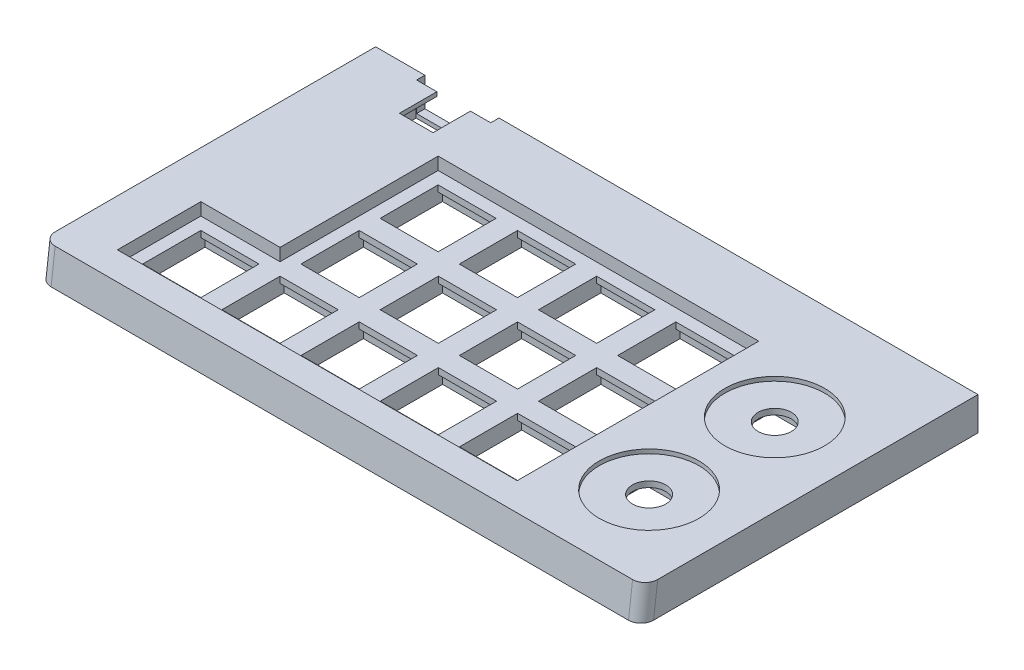
from build123d import *

# Parameters (mm, degrees)
SKETCH1_W           = 14
SKETCH1_H           = 14
SKETCH1_W_2         = 13.96
SKETCH1_H_2         = 13.96
SKETCH1_W_3         = 17.83
SKETCH1_H_3         = 34.365
SKETCH1_W_4         = 16.8
SKETCH1_H_4         = 14.955
BOSS_EXTRUDE2_DEPTH = 4
SKETCH3_W           = 14
SKETCH3_H           = 16
CUT_EXTRUDE1_DEPTH  = 2.5
SKETCH6_W           = 145
SKETCH6_H           = 81.124541
BOSS_EXTRUDE3_DEPTH = 7
SKETCH12_R          = 0.8
CUT_EXTRUDE5_DEPTH  = 6
SKETCH13_W          = 17.97
SKETCH13_H          = 46.826347
CUT_EXTRUDE6_DEPTH  = 6
SKETCH14_W          = 16.8
SKETCH14_H          = 14.955
CUT_EXTRUDE8_DEPTH  = 4.6
SKETCH15_R          = 4
CUT_EXTRUDE9_DEPTH  = 10
SKETCH16_R          = 12
CUT_EXTRUDE10_DEPTH = 1
SKETCH20_W          = 145
SKETCH20_H          = 81.124541
SKETCH20_W_2        = 130
SKETCH20_H_2        = 66.1
BOSS_EXTRUDE5_DEPTH = 1
SKETCH21_W          = 145
SKETCH21_H          = 34.866824831
CUT_EXTRUDE11_DEPTH = 18
FILLET1_R           = 3
SKETCH27_W          = 17.97
SKETCH27_H          = 5.776347
CUT_EXTRUDE13_DEPTH = 2
CUT_EXTRUDE14_START = -2
CUT_EXTRUDE14_DEPTH = 2
SKETCH28_W          = 17.854591413
SKETCH28_H          = 5
CUT_EXTRUDE15_DEPTH = 2


# Read off the part's stored shape, not the designer's step: Cut-Extrude14
with BuildPart() as part:
    # Sketch1 → Boss-Extrude2 (new body)
    with BuildSketch(Plane(origin=(0, 0, 0), x_dir=(1, 0, 0), z_dir=(0, 1, 0))):
        Polygon((0, 0), (109.34, 0), (130, 0), (130, 66.1), (0, 66.1), align=None)
        with Locations((51.87, 10.55)):
            Rectangle(SKETCH1_W, SKETCH1_H, mode=Mode.SUBTRACT)
        with Locations((32.81, 10.55)):
            Rectangle(SKETCH1_W, SKETCH1_H, mode=Mode.SUBTRACT)
        with Locations((32.81, 29.6)):
            Rectangle(SKETCH1_W, SKETCH1_H, mode=Mode.SUBTRACT)
        with Locations((32.79, 48.63)):
            Rectangle(SKETCH1_W_2, SKETCH1_H_2, mode=Mode.SUBTRACT)
        with Locations((13.145, 42.2325)):
            Rectangle(SKETCH1_W_3, SKETCH1_H_3, mode=Mode.SUBTRACT)
        with Locations((13.75, 10.55)):
            Rectangle(SKETCH1_W, SKETCH1_H, mode=Mode.SUBTRACT)
        with Locations((51.87, 29.6)):
            Rectangle(SKETCH1_W, SKETCH1_H, mode=Mode.SUBTRACT)
        with Locations((70.93, 10.55)):
            Rectangle(SKETCH1_W, SKETCH1_H, mode=Mode.SUBTRACT)
        with Locations((89.99, 10.55)):
            Rectangle(SKETCH1_W, SKETCH1_H, mode=Mode.SUBTRACT)
        with Locations((117.74, 14.4625)):
            Rectangle(SKETCH1_W_4, SKETCH1_H_4, mode=Mode.SUBTRACT)
        with Locations((70.93, 29.6)):
            Rectangle(SKETCH1_W, SKETCH1_H, mode=Mode.SUBTRACT)
        with Locations((89.99, 29.6)):
            Rectangle(SKETCH1_W, SKETCH1_H, mode=Mode.SUBTRACT)
        with Locations((51.87, 48.65)):
            Rectangle(SKETCH1_W, SKETCH1_H, mode=Mode.SUBTRACT)
        with Locations((70.93, 48.65)):
            Rectangle(SKETCH1_W, SKETCH1_H, mode=Mode.SUBTRACT)
        with Locations((89.99, 48.65)):
            Rectangle(SKETCH1_W, SKETCH1_H, mode=Mode.SUBTRACT)
        with Locations((117.74, 44.7175)):
            Rectangle(SKETCH1_W_4, SKETCH1_H_4, mode=Mode.SUBTRACT)
    extrude(amount=BOSS_EXTRUDE2_DEPTH)

    # Sketch3 → Cut-Extrude1 (cut)
    with BuildSketch(Plane(origin=(0, 0, 0), x_dir=(1, 0, 0), z_dir=(0, 1, 0))):
        with Locations((89.99, 29.6)):
            Rectangle(SKETCH3_W, SKETCH3_H)
        with Locations((70.93, 29.6)):
            Rectangle(SKETCH3_W, SKETCH3_H)
        with Locations((89.99, 48.65)):
            Rectangle(SKETCH3_W, SKETCH3_H)
        with Locations((70.93, 48.65)):
            Rectangle(SKETCH3_W, SKETCH3_H)
        with Locations((51.87, 48.65)):
            Rectangle(SKETCH3_W, SKETCH3_H)
        with Locations((32.81, 48.65)):
            Rectangle(SKETCH3_W, SKETCH3_H)
        with Locations((32.81, 29.650197757)):
            Rectangle(SKETCH3_W, SKETCH3_H)
        with Locations((51.87, 29.6)):
            Rectangle(SKETCH3_W, SKETCH3_H)
        with Locations((13.75, 10.55)):
            Rectangle(SKETCH3_W, SKETCH3_H)
        with Locations((32.81, 10.55)):
            Rectangle(SKETCH3_W, SKETCH3_H)
        with Locations((51.87, 10.55)):
            Rectangle(SKETCH3_W, SKETCH3_H)
        with Locations((70.93, 10.55)):
            Rectangle(SKETCH3_W, SKETCH3_H)
        with Locations((89.99, 10.55)):
            Rectangle(SKETCH3_W, SKETCH3_H)
    extrude(amount=CUT_EXTRUDE1_DEPTH, mode=Mode.SUBTRACT)

    # Sketch6 → Boss-Extrude3 (add)
    with BuildSketch(Plane(origin=(0, 0, 0), x_dir=(-1, 0, 0), z_dir=(0, -1, 0))):
        with Locations((-65, 33.3140765)):
            Rectangle(SKETCH6_W, SKETCH6_H)
        Polygon((-99.99, 58.61), (-39.77, 58.61), (-22.81, 58.61), (-22.81, 53.222321133), (-22.81, 20.55), (-3.75, 20.55), (-3.75, 12.496372948), (-3.75, 0.461789698), (-20.75, 0.461789698), (-99.99, 0.461789698), align=None, mode=Mode.SUBTRACT)
    extrude(amount=-BOSS_EXTRUDE3_DEPTH)

    # Sketch12 → Cut-Extrude5 (cut)
    with BuildSketch(Plane(origin=(0, 0, 0), x_dir=(-1, 0, 0), z_dir=(0, -1, 0))):
        with BuildLine():
            ThreePointArc((-1.45, 63.85), (-1.684314575, 64.415685425), (-2.25, 64.65))
            Line((-2.25, 64.65), (-2.25, 63.85))
            Line((-2.25, 63.85), (-1.45, 63.85))
        make_face()
        with BuildLine():
            Line((-2.25, 63.85), (-2.25, 64.65))
            ThreePointArc((-2.25, 64.65), (-2.815685425, 63.284314575), (-1.45, 63.85))
            Line((-1.45, 63.85), (-2.25, 63.85))
        make_face()
        with BuildLine():
            ThreePointArc((-1.45, 2.25), (-2.815685425, 2.815685425), (-2.25, 1.45))
            Line((-2.25, 1.45), (-2.25, 2.25))
            Line((-2.25, 2.25), (-1.45, 2.25))
        make_face()
        with BuildLine():
            Line((-2.25, 2.25), (-2.25, 1.45))
            ThreePointArc((-2.25, 1.45), (-1.684314575, 1.684314575), (-1.45, 2.25))
            Line((-1.45, 2.25), (-2.25, 2.25))
        make_face()
        with BuildLine():
            ThreePointArc((-128.55, 2.25), (-128.315685425, 1.684314575), (-127.75, 1.45))
            Line((-127.75, 1.45), (-127.75, 2.25))
            Line((-127.75, 2.25), (-128.55, 2.25))
        make_face()
        with BuildLine():
            Line((-127.75, 2.25), (-127.75, 1.45))
            ThreePointArc((-127.75, 1.45), (-127.184314575, 1.684314575), (-126.95, 2.25))
            ThreePointArc((-126.95, 2.25), (-127.75, 3.05), (-128.55, 2.25))
            Line((-128.55, 2.25), (-127.75, 2.25))
        make_face()
        with Locations(Location((-127.75, 63.85, 0), (0, 0, 90))):
            Circle(SKETCH12_R)
    extrude(amount=-CUT_EXTRUDE5_DEPTH, mode=Mode.SUBTRACT)

    # Sketch13 → Cut-Extrude6 (cut)
    with BuildSketch(Plane.XZ):
        with Locations((13.215, -48.4631735)):
            Rectangle(SKETCH13_W, SKETCH13_H)
    extrude(amount=-CUT_EXTRUDE6_DEPTH, mode=Mode.SUBTRACT)

    # Sketch14 → Cut-Extrude8 (cut)
    with BuildSketch(Plane.XZ):
        with Locations((117.74, -14.4625)):
            Rectangle(SKETCH14_W, SKETCH14_H)
        with Locations((117.74, -44.7175)):
            Rectangle(SKETCH14_W, SKETCH14_H)
    extrude(amount=-CUT_EXTRUDE8_DEPTH, mode=Mode.SUBTRACT)

    # Sketch15 → Cut-Extrude9 (cut)
    with BuildSketch(Plane.XZ):
        with Locations(Location((117.74, -44.7175, 0), (0, 0, 270))):
            Circle(SKETCH15_R)
        with Locations(Location((117.74, -14.4625, 0), (0, 0, 270))):
            Circle(SKETCH15_R)
    extrude(amount=-CUT_EXTRUDE9_DEPTH, mode=Mode.SUBTRACT)

    # Sketch16 → Cut-Extrude10 (cut)
    with BuildSketch(Plane(origin=(0, 7, 0), x_dir=(1, 0, 0), z_dir=(0, 1, 0))):
        with Locations(Location((117.74, 44.7175, 0), (0, 0, 270))):
            Circle(SKETCH16_R)
        with Locations(Location((117.74, 14.4625, 0), (0, 0, 270))):
            Circle(SKETCH16_R)
    extrude(amount=-CUT_EXTRUDE10_DEPTH, mode=Mode.SUBTRACT)

    # Sketch20 → Boss-Extrude5 (add)
    with BuildSketch(Plane.XZ):
        with Locations((65, -33.3140765)):
            Rectangle(SKETCH20_W, SKETCH20_H)
        with Locations((65, -33.05)):
            Rectangle(SKETCH20_W_2, SKETCH20_H_2, mode=Mode.SUBTRACT)
    extrude(amount=BOSS_EXTRUDE5_DEPTH)

    # Sketch21 → Cut-Extrude11 (cut)
    with BuildSketch(Plane(origin=(0, -1.861896279, 0.228612117), x_dir=(-1, 0, 0), z_dir=(0, 0.9925461516413211, -0.1218693434051548))):
        with Locations((-65, 24.505710134)):
            Rectangle(SKETCH21_W, SKETCH21_H)
    extrude(amount=CUT_EXTRUDE11_DEPTH, mode=Mode.SUBTRACT)

    # Fillet1
    fillet1_edges = [part.edges().sort_by_distance(p)[0] for p in [
        (-7.5, 3, 6.757055756),
        (137.5, 3, 6.757055756),
    ]]
    fillet(fillet1_edges, radius=FILLET1_R)

    # Sketch27 → Cut-Extrude13 (cut)
    with BuildSketch(Plane.XZ):
        with Locations((13.215, -68.9881735)):
            Rectangle(SKETCH27_W, SKETCH27_H)
    extrude(amount=CUT_EXTRUDE13_DEPTH, mode=Mode.SUBTRACT)

    # Cut-Extrude14 outline → Cut-Extrude14 (cut)
    with BuildSketch(Plane(origin=(0, 7, 0), x_dir=(1, 0, 0), z_dir=(0, 1, 0)).offset(CUT_EXTRUDE14_START)):
        Polygon((4.351462148, 71.876347), (9.23, 71.876347), (9.23, 62.876347), (17.321462297, 62.876347), (17.321462297, 71.876347), (22.2, 71.876347), (22.2, 73.876347), (4.351462148, 73.876347), align=None)
    extrude(amount=CUT_EXTRUDE14_DEPTH, mode=Mode.SUBTRACT)

    # Sketch28 → Cut-Extrude15 (cut)
    with BuildSketch(Plane(origin=(0, 0, -73.876347), x_dir=(-1, 0, 0), z_dir=(0, 0, -1))):
        with Locations((-13.272704442, 2.5)):
            Rectangle(SKETCH28_W, SKETCH28_H)
    extrude(amount=-CUT_EXTRUDE15_DEPTH, mode=Mode.SUBTRACT)


solid = part.part
